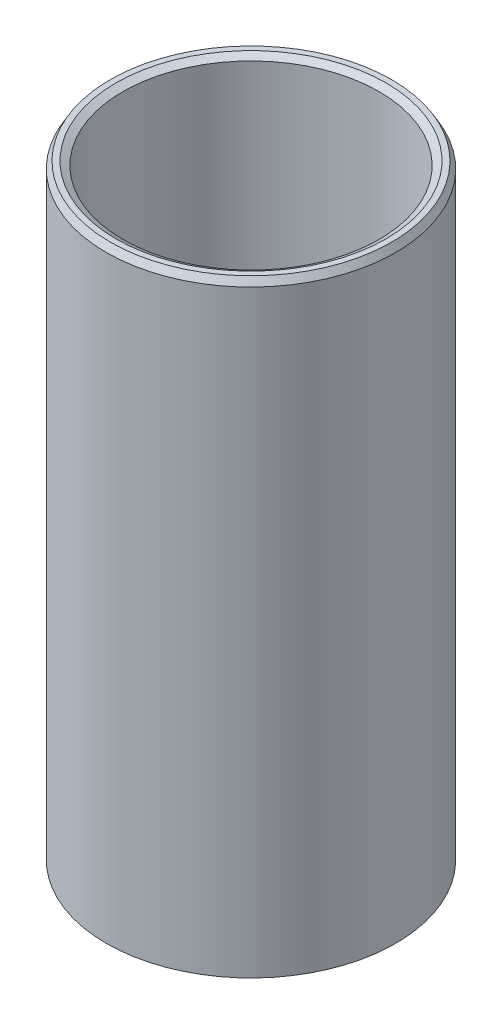
from build123d import *
from OCP.BRepFilletAPI import BRepFilletAPI_MakeChamfer

# Parameters (mm, degrees)
SKETCH1_R           = 37.5
BOSS_EXTRUDE1_DEPTH = 157.85949723
SKETCH2_R           = 33.186971225
CUT_EXTRUDE1_DEPTH  = 167.529639601
CHAMFER1_SIZE       = 1.803910841
CHAMFER1_SIZE2      = 1.04148841


with BuildPart() as part:
    # Sketch1 → Boss-Extrude1 (new body)
    with BuildSketch(Plane(origin=(0, 0, 0), x_dir=(1, 0, 0), z_dir=(0, 1, 0))):
        Circle(SKETCH1_R)
    extrude(amount=BOSS_EXTRUDE1_DEPTH)

    # Sketch2 → Cut-Extrude1 (cut, through all)
    with BuildSketch(Plane(origin=(0, 0, 0), x_dir=(1, 0, 0), z_dir=(0, 1, 0))):
        Circle(SKETCH2_R)
    extrude(amount=CUT_EXTRUDE1_DEPTH, mode=Mode.SUBTRACT)

    # Chamfer1: one chamfer whose edges measure the first distance from different faces: ONE call of the kernel's chamfer builder (chamfer() names one face for all edges)
    chamfer1_edges_1 = [part.edges().sort_by_distance(p)[0] for p in [
        (-33.186971225, 157.85949723, 0),
    ]]
    chamfer1_side_1 = [part.faces().sort_by_distance(p)[0] for p in [
        (-36.439339828, 157.85949723, 0),
    ]]
    chamfer1_edges_2 = [part.edges().sort_by_distance(p)[0] for p in [
        (-33.186971225, 0, 0),
    ]]
    chamfer1_side_2 = [part.faces().sort_by_distance(p)[0] for p in [
        (-33.186971225, 78.929748615, 0),
    ]]
    chamfer1_edges_3 = [part.edges().sort_by_distance(p)[0] for p in [
        (-37.5, 0, 0),
    ]]
    chamfer1_side_3 = [part.faces().sort_by_distance(p)[0] for p in [
        (-36.439339828, 0, 0),
    ]]
    chamfer1_edges_4 = [part.edges().sort_by_distance(p)[0] for p in [
        (-37.5, 157.85949723, 0),
    ]]
    chamfer1_side_4 = [part.faces().sort_by_distance(p)[0] for p in [
        (-37.5, 78.929748615, 0),
    ]]
    chamfer1 = BRepFilletAPI_MakeChamfer(part.part.solid().wrapped)
    for e in chamfer1_edges_1:
        chamfer1.Add(CHAMFER1_SIZE, CHAMFER1_SIZE2, e.wrapped, chamfer1_side_1[0].wrapped)  # the first distance lies on this face
    for e in chamfer1_edges_2:
        chamfer1.Add(CHAMFER1_SIZE, CHAMFER1_SIZE2, e.wrapped, chamfer1_side_2[0].wrapped)  # the first distance lies on this face
    for e in chamfer1_edges_3:
        chamfer1.Add(CHAMFER1_SIZE, CHAMFER1_SIZE2, e.wrapped, chamfer1_side_3[0].wrapped)  # the first distance lies on this face
    for e in chamfer1_edges_4:
        chamfer1.Add(CHAMFER1_SIZE, CHAMFER1_SIZE2, e.wrapped, chamfer1_side_4[0].wrapped)  # the first distance lies on this face
    add(Compound.cast(chamfer1.Shape()), mode=Mode.REPLACE)


solid = part.part
